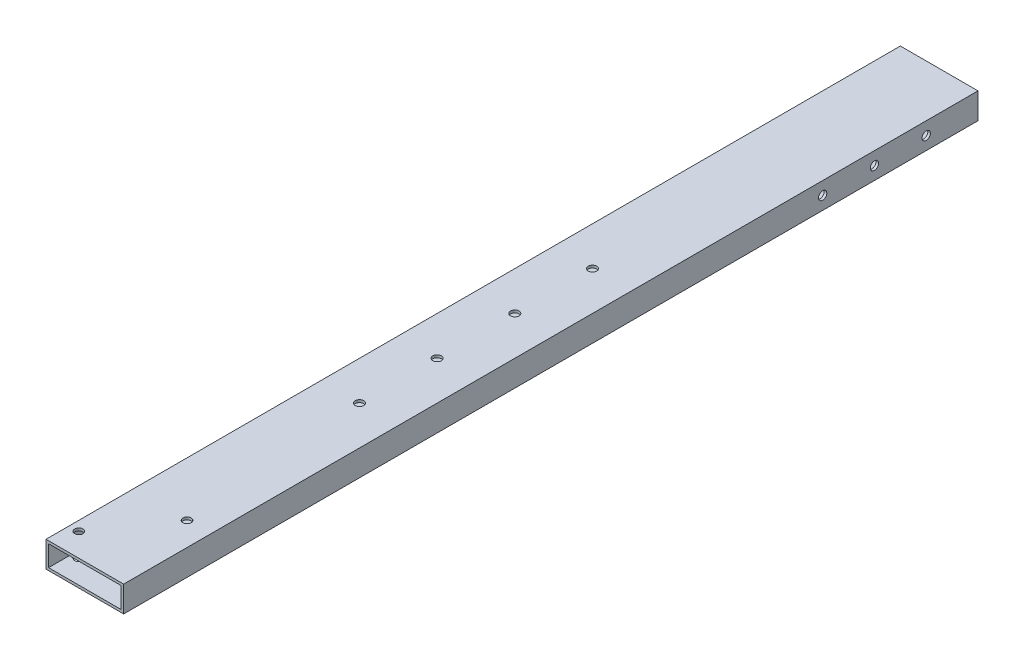
from build123d import *

# Parameters (mm, degrees)
SKETCH_1_W          = 30
SKETCH_1_H          = 10
SKETCH_1_W_2        = 26
SKETCH_1_H_2        = 6
EXTRUDE_1_DEPTH     = 330
SKETCH_2_R          = 1.6
CUT_EXTRUDE_1_DEPTH = 331.492057393
SKETCH_3_R          = 1.6
SKETCH_3_R_2        = 1.65
CUT_EXTRUDE_2_DEPTH = 331.492057393
SKETCH_4_R          = 1.6
CUT_EXTRUDE_3_DEPTH = 332.398551596
SKETCH_6_W          = 28
SKETCH_6_H          = 8
CUT_EXTRUDE_5_DEPTH = 355


with BuildPart() as part:
    # 草图1 → 凸台-拉伸1 (new body)
    with BuildSketch(Plane.XY):
        Rectangle(SKETCH_1_W, SKETCH_1_H)
        Rectangle(SKETCH_1_W_2, SKETCH_1_H_2, mode=Mode.SUBTRACT)
    extrude(amount=EXTRUDE_1_DEPTH)

    # 草图2 → 切除-拉伸1 (cut, through all)
    with BuildSketch(Plane(origin=(0, 5, 0), x_dir=(1, 0, 0), z_dir=(0, 1, 0))):
        with Locations((-11.3, -321)):
            Circle(SKETCH_2_R)
    extrude(amount=-CUT_EXTRUDE_1_DEPTH, mode=Mode.SUBTRACT)

    # 草图3 → 切除-拉伸2 (cut, through all)
    with BuildSketch(Plane(origin=(0, 5, 0), x_dir=(1, 0, 0), z_dir=(0, 1, 0))):
        with Locations((5.907293091, -296.425438671)):
            Circle(SKETCH_3_R)
        with Locations((0, -163.912345182)):
            Circle(SKETCH_3_R_2)
        with Locations((0, -133.912345182)):
            Circle(SKETCH_3_R_2)
        with Locations((0, -223.912345182)):
            Circle(SKETCH_3_R_2)
        with Locations((0, -193.912345182)):
            Circle(SKETCH_3_R_2)
    extrude(amount=-CUT_EXTRUDE_2_DEPTH, mode=Mode.SUBTRACT)

    # 草图4 → 切除-拉伸3 (cut, through all)
    with BuildSketch(Plane.ZY.offset(15)):
        with Locations((20, 0)):
            Circle(SKETCH_4_R)
        with Locations((40, 0)):
            Circle(SKETCH_4_R)
        with Locations((60, 0)):
            Circle(SKETCH_4_R)
    extrude(amount=-CUT_EXTRUDE_3_DEPTH, mode=Mode.SUBTRACT)

    # 草图6 → 切除-拉伸5 (cut)
    with BuildSketch(Plane(origin=(0, 0, 0), x_dir=(-1, 0, 0), z_dir=(0, 0, -1))):
        Rectangle(SKETCH_6_W, SKETCH_6_H)
    extrude(amount=-CUT_EXTRUDE_5_DEPTH, mode=Mode.SUBTRACT)


solid = part.part
